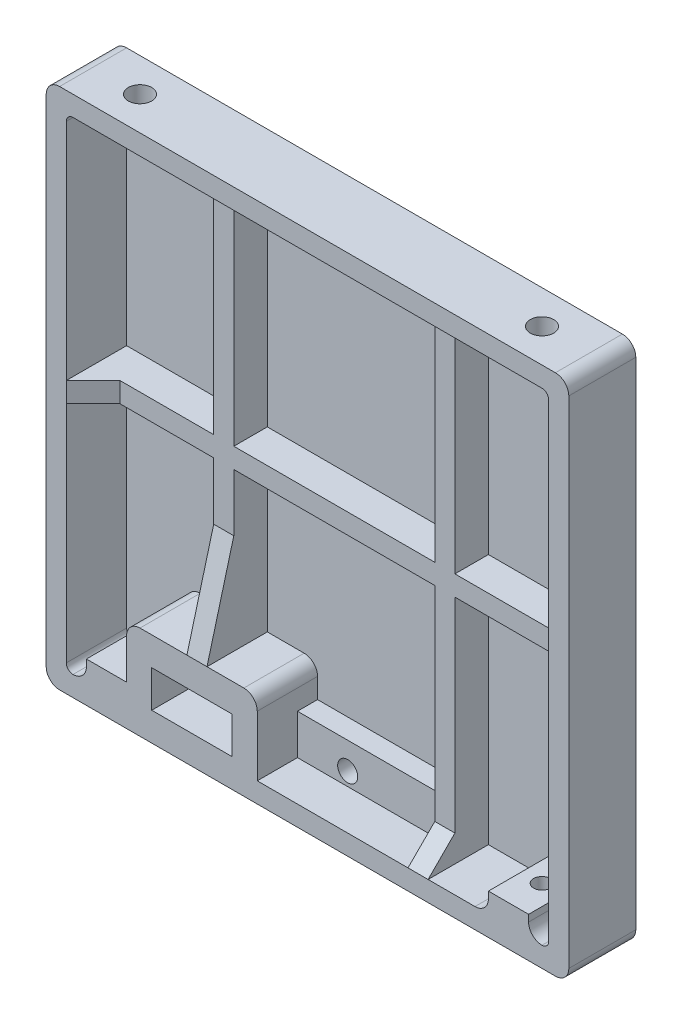
from build123d import *

# Parameters (mm, degrees)
SKETCH1_W                 = 78
SKETCH1_H                 = 78
BOSS_EXTRUDE1_DEPTH       = 10
SHELL1_T                  = -3
SHELL1_THICKNESS_2_FACE_W = 72
SHELL1_THICKNESS_2_FACE_H = 72
SHELL1_THICKNESS_2_DEPTH  = 2
SKETCH10_R                = 1.25
CUT_EXTRUDE7_DEPTH        = 57.053545829
FILLET5_R                 = 2
FILLET6_R                 = 1
BOSS_EXTRUDE2_START       = 3
SKETCH15_W                = 6
SKETCH15_H                = 9
SKETCH15_R                = 1.25
BOSS_EXTRUDE2_DEPTH       = 3
FILLET7_R                 = 2
FILLET7_OF_MIRROR5_R      = 2
SKETCH16_R                = 1.75
CUT_EXTRUDE9_DEPTH        = 86.12343978
SKETCH20_W                = 19.5
SKETCH20_H                = 11
BOSS_EXTRUDE3_DEPTH       = 10
CUT_EXTRUDE10_START       = -1.5
SKETCH21_W                = 16
SKETCH21_H                = 9.5
CUT_EXTRUDE10_DEPTH       = 55.553545829
SKETCH22_W                = 12
SKETCH22_H                = 5.5
CUT_EXTRUDE11_DEPTH       = 56.805465682
SKETCH22_2_W              = 13
SKETCH22_2_H              = 6.5
SKETCH22_2_W_2            = 12
SKETCH22_2_H_2            = 5.5
EXTRUDE_THIN3_DEPTH       = 8.5
FILLET8_R                 = 2
SKETCH26_W                = 22.5
SKETCH26_H                = 6
BOSS_EXTRUDE4_DEPTH       = 3
SKETCH13_R                = 1.5
CUT_EXTRUDE8_DEPTH        = 57.053545829
SKETCH28_W                = 3
SKETCH28_H                = 61
SKETCH28_H_2              = 72
BOSS_EXTRUDE5_DEPTH       = 5
SKETCH29_W                = 72
SKETCH29_H                = 3
BOSS_EXTRUDE6_DEPTH       = 5
CHAMFER1_SIZE2            = 14.92820323
CHAMFER1_SIZE             = 4
CHAMFER2_SIZE             = 4


with BuildPart() as part:
    # Sketch1 → Boss-Extrude1 (new body)
    with BuildSketch(Plane.XY):
        Rectangle(SKETCH1_W, SKETCH1_H)
    extrude(amount=BOSS_EXTRUDE1_DEPTH)

    # Shell1
    shell1_openings = [part.faces().sort_by_distance(p)[0] for p in [
        (0, 0, 10),
    ]]
    offset(amount=SHELL1_T, openings=shell1_openings, kind=Kind.INTERSECTION)

    # Shell1 thickness 2 face (on inner face of the shell) → Shell1 thickness 2 (cut)
    with BuildSketch(Plane(origin=(0, 0, 3), x_dir=(-1, 0, 0), z_dir=(0, 0, -1))):
        Rectangle(SHELL1_THICKNESS_2_FACE_W, SHELL1_THICKNESS_2_FACE_H)
    extrude(amount=SHELL1_THICKNESS_2_DEPTH, mode=Mode.SUBTRACT)

    # Sketch10 → Cut-Extrude7 (cut, symmetric)
    with BuildSketch(Plane(origin=(0, 0, 0), x_dir=(1, 0, 0), z_dir=(0, 1, 0))):
        with Locations(Location((-30, -5, 0), (0, 0, 270))):
            Circle(SKETCH10_R)
    cut_extrude7 = extrude(amount=CUT_EXTRUDE7_DEPTH, both=True, mode=Mode.SUBTRACT)

    # Mirror4: Cut-Extrude7 across plane
    add(cut_extrude7.mirror(Plane(origin=(0, 0, 0), x_dir=(0, 0, 1), z_dir=(1, 0, 0))), mode=Mode.SUBTRACT)

    # Fillet5
    fillet5_edges = [part.edges().sort_by_distance(p)[0] for p in [
        (39, -39, 5),
        (-39, -39, 5),
        (-39, 39, 5),
        (39, 39, 5),
    ]]
    fillet(fillet5_edges, radius=FILLET5_R)

    # Fillet6
    fillet6_edges = [part.edges().sort_by_distance(p)[0] for p in [
        (36, -36, 5.5),
        (36, 36, 5.5),
        (-36, 36, 5.5),
        (-36, -36, 5.5),
    ]]
    fillet(fillet6_edges, radius=FILLET6_R)

    # Sketch15 → Boss-Extrude2 (add)
    with BuildSketch(Plane(origin=(0, -36, 0), x_dir=(1, 0, 0), z_dir=(0, 1, 0)).offset(BOSS_EXTRUDE2_START)):
        with Locations((-30, -5.5)):
            Rectangle(SKETCH15_W, SKETCH15_H)
        with Locations(Location((-30, -5, 0), (0, 0, 270))):
            Circle(SKETCH15_R, mode=Mode.SUBTRACT)
    boss_extrude2 = extrude(amount=-BOSS_EXTRUDE2_DEPTH)

    # Fillet7
    fillet7_edges = [part.edges().sort_by_distance(p)[0] for p in [
        (-33, -36, 5.5),
        (-27, -36, 5.5),
    ]]
    fillet(fillet7_edges, radius=FILLET7_R - 0.0001)  # a hair under: the kernel refuses the full size

    # Mirror5: Boss-Extrude2 across plane
    add(boss_extrude2.mirror(Plane(origin=(0, 0, 0), x_dir=(0, 0, 1), z_dir=(1, 0, 0))))

    # Fillet7 of Mirror5
    fillet7_of_mirror5_edges = [part.edges().sort_by_distance(p)[0] for p in [
        (33, -36, 5.5),
        (27, -36, 5.5),
    ]]
    fillet(fillet7_of_mirror5_edges, radius=FILLET7_OF_MIRROR5_R - 0.0001)  # a hair under: the kernel refuses the full size

    # Sketch16 → Cut-Extrude9 (cut, through all)
    with BuildSketch(Plane.XZ.offset(-36)):
        with Locations(Location((-30, 5, 0), (0, 0, 270))):
            Circle(SKETCH16_R)
        with Locations(Location((30, 5, 0), (0, 0, 270))):
            Circle(SKETCH16_R)
    extrude(amount=-CUT_EXTRUDE9_DEPTH, mode=Mode.SUBTRACT)

    # Sketch20 → Boss-Extrude3 (add)
    with BuildSketch(Plane(origin=(0, 0, 0), x_dir=(-1, 0, 0), z_dir=(0, 0, -1))):
        with Locations((17.25, -30.5)):
            Rectangle(SKETCH20_W, SKETCH20_H)
    extrude(amount=-BOSS_EXTRUDE3_DEPTH)

    # Sketch21 → Cut-Extrude10 (cut, through all)
    with BuildSketch(Plane.XY.offset(10).offset(CUT_EXTRUDE10_START)):
        with Locations((-17.25, -32)):
            Rectangle(SKETCH21_W, SKETCH21_H)
    extrude(amount=-CUT_EXTRUDE10_DEPTH, mode=Mode.SUBTRACT)

    # Sketch22 → Cut-Extrude11 (cut, through all)
    with BuildSketch(Plane(origin=(0, 0, 8.5), x_dir=(-1, 0, 0), z_dir=(0, 0, -1))):
        with Locations((17.25, -32)):
            Rectangle(SKETCH22_W, SKETCH22_H)
    extrude(amount=-CUT_EXTRUDE11_DEPTH, mode=Mode.SUBTRACT)

    # Sketch22<2> → Extrude-Thin3 (add)
    with BuildSketch(Plane(origin=(0, 0, 8.5), x_dir=(-1, 0, 0), z_dir=(0, 0, -1))):
        with Locations((17.25, -32)):
            Rectangle(SKETCH22_2_W, SKETCH22_2_H)
        with Locations((17.25, -32)):
            Rectangle(SKETCH22_2_W_2, SKETCH22_2_H_2, mode=Mode.SUBTRACT)
    extrude(amount=EXTRUDE_THIN3_DEPTH)

    # Fillet8
    fillet8_edges = [part.edges().sort_by_distance(p)[0] for p in [
        (-7.5, -25, 5.5),
        (-27, -25, 5.5),
    ]]
    fillet(fillet8_edges, radius=FILLET8_R)

    # Sketch26 → Boss-Extrude4 (add)
    with BuildSketch(Plane.XY.offset(1)):
        with Locations((3.75, -33)):
            Rectangle(SKETCH26_W, SKETCH26_H)
    extrude(amount=BOSS_EXTRUDE4_DEPTH)

    # Sketch13 → Cut-Extrude8 (cut, through all)
    with BuildSketch(Plane.XY):
        with Locations((0, -34)):
            Circle(SKETCH13_R)
    extrude(amount=CUT_EXTRUDE8_DEPTH, mode=Mode.SUBTRACT)

    # Sketch28 → Boss-Extrude5 (add)
    with BuildSketch(Plane.XY.offset(1)):
        with Locations((-16.5, 5.5)):
            Rectangle(SKETCH28_W, SKETCH28_H)
        with Locations((16.5, 0)):
            Rectangle(SKETCH28_W, SKETCH28_H_2)
    extrude(amount=BOSS_EXTRUDE5_DEPTH)

    # Sketch29 → Boss-Extrude6 (add)
    with BuildSketch(Plane.XY.offset(1)):
        Rectangle(SKETCH29_W, SKETCH29_H)
    extrude(amount=BOSS_EXTRUDE6_DEPTH)

    # Chamfer1
    chamfer1_edges = [part.edges().sort_by_distance(p)[0] for p in [
        (-16.5, -25, 6),
    ]]
    chamfer1_side = [part.faces().sort_by_distance(p)[0] for p in [
        (-16.5, -25, 6.08),
    ]]
    chamfer(chamfer1_edges, length=CHAMFER1_SIZE - 0.0001, length2=CHAMFER1_SIZE2 - 0.0001, reference=chamfer1_side[0])  # a hair under: the kernel refuses the full size

    # Chamfer2
    chamfer2_edges = [part.edges().sort_by_distance(p)[0] for p in [
        (-16.5, 36, 6),
        (16.5, -36, 6),
        (16.5, 36, 6),
        (36, 0, 6),
        (-36, 0, 6),
    ]]
    chamfer(chamfer2_edges, length=CHAMFER2_SIZE - 0.0001)  # a hair under: the kernel refuses the full size


solid = part.part
